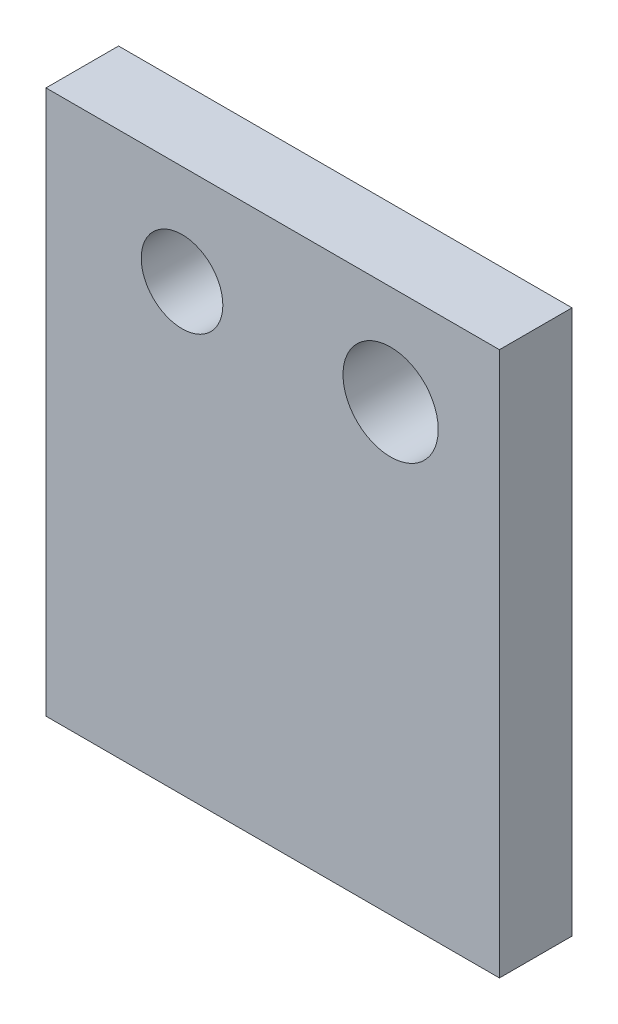
from build123d import *

# Parameters (mm, degrees)
SKETCH1_W           = 50
SKETCH1_H           = 60
SKETCH1_R           = 4.5
BOSS_EXTRUDE1_DEPTH = 8
SKETCH2_R           = 5.25
CUT_EXTRUDE2_DEPTH  = 40.862262856


with BuildPart() as part:
    # Sketch1 → Boss-Extrude1 (new body)
    with BuildSketch(Plane.XY):
        Rectangle(SKETCH1_W, SKETCH1_H)
        with Locations((-10, 19)):
            Circle(SKETCH1_R, mode=Mode.SUBTRACT)
    extrude(amount=BOSS_EXTRUDE1_DEPTH)

    # Sketch2 → Cut-Extrude2 (cut, through all)
    with BuildSketch(Plane.XY):
        with Locations((13, 19)):
            Circle(SKETCH2_R)
    extrude(amount=CUT_EXTRUDE2_DEPTH, mode=Mode.SUBTRACT)


solid = part.part
